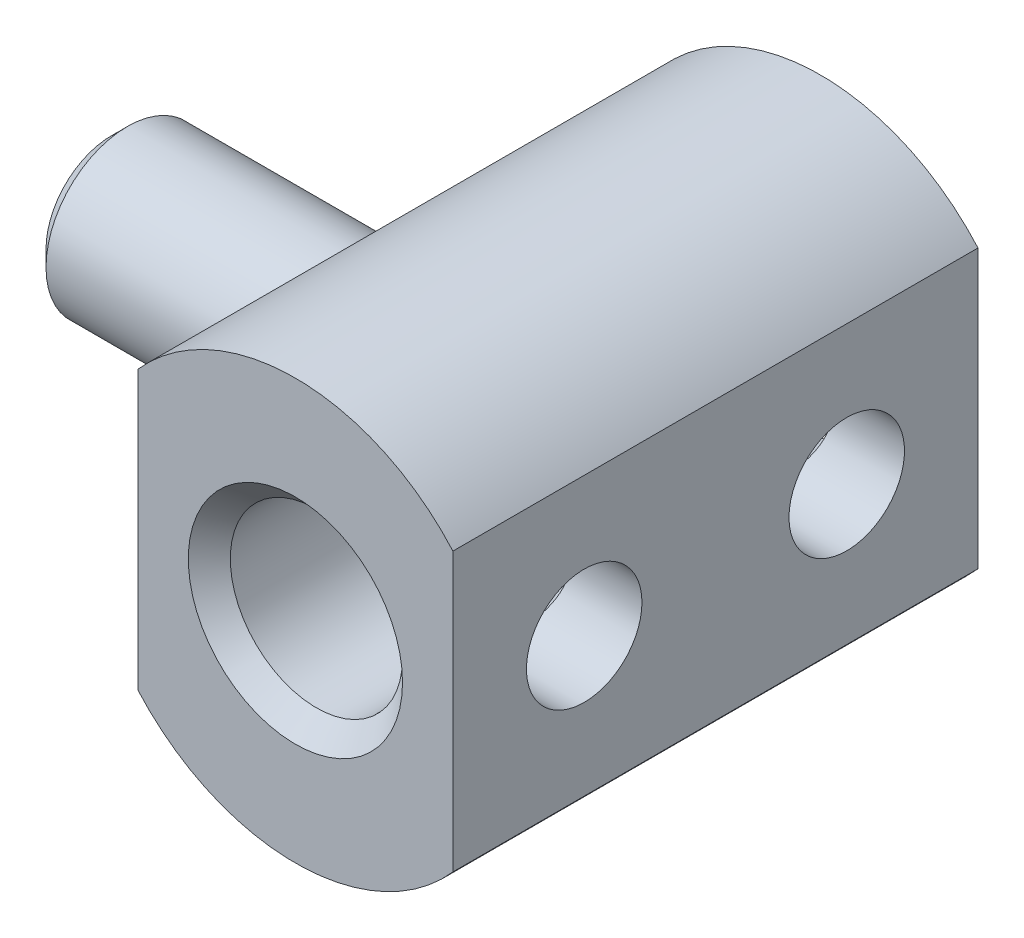
from build123d import *

# Parameters (mm, degrees)
SKETCH1_R           = 5.08
SKETCH1_R_2         = 2.0828
BOSS_EXTRUDE1_DEPTH = 6.35
CUT_EXTRUDE1_DEPTH  = 15.591189122
SKETCH4_R           = 1.9685
BOSS_EXTRUDE2_DEPTH = 6.985
FILLET1_R           = 1.27
CHAMFER1_SIZE       = 0.381
SKETCH5_R           = 1.397
CUT_EXTRUDE2_DEPTH  = 3.81
CHAMFER2_SIZE       = 0.508


with BuildPart() as part:
    # Sketch1 → Boss-Extrude1 (new, symmetric)
    with BuildSketch(Plane.XY):
        Circle(SKETCH1_R)
        Circle(SKETCH1_R_2, mode=Mode.SUBTRACT)
    extrude(amount=BOSS_EXTRUDE1_DEPTH, both=True)

    # Sketch3 → Cut-Extrude1 (cut, through all)
    with BuildSketch(Plane.XY.offset(6.35)):
        with BuildLine():
            Line((-3.81, 3.360104165), (-3.81, -3.360104165))
            ThreePointArc((-3.81, -3.360104165), (-5.08, 0), (-3.81, 3.360104165))
        make_face()
        with BuildLine():
            Line((3.81, 3.360104165), (3.81, -3.360104165))
            ThreePointArc((3.81, -3.360104165), (5.08, 0), (3.81, 3.360104165))
        make_face()
    extrude(amount=-CUT_EXTRUDE1_DEPTH, mode=Mode.SUBTRACT)

    # Sketch4 → Boss-Extrude2 (add)
    with BuildSketch(Plane.ZY.offset(3.81)):
        Circle(SKETCH4_R)
    extrude(amount=BOSS_EXTRUDE2_DEPTH)

    # Fillet1
    fillet1_edges = [part.edges().sort_by_distance(p)[0] for p in [
        (-3.81, 0, -1.9685),
    ]]
    fillet(fillet1_edges, radius=FILLET1_R)

    # Chamfer1
    chamfer1_edges = [part.edges().sort_by_distance(p)[0] for p in [
        (-10.795, 0, -1.9685),
    ]]
    chamfer(chamfer1_edges, length=CHAMFER1_SIZE)

    # Sketch5 → Cut-Extrude2 (cut)
    with BuildSketch(Plane(origin=(3.81, 0, 0), x_dir=(0, 0, -1), z_dir=(1, 0, 0))):
        with Locations((-3.175, 0)):
            Circle(SKETCH5_R)
        with Locations((3.175, 0)):
            Circle(SKETCH5_R)
    extrude(amount=-CUT_EXTRUDE2_DEPTH, mode=Mode.SUBTRACT)

    # Chamfer2
    chamfer2_edges = [part.edges().sort_by_distance(p)[0] for p in [
        (-2.0828, 0, -6.35),
        (-2.0828, 0, 6.35),
    ]]
    chamfer(chamfer2_edges, length=CHAMFER2_SIZE)


solid = part.part
